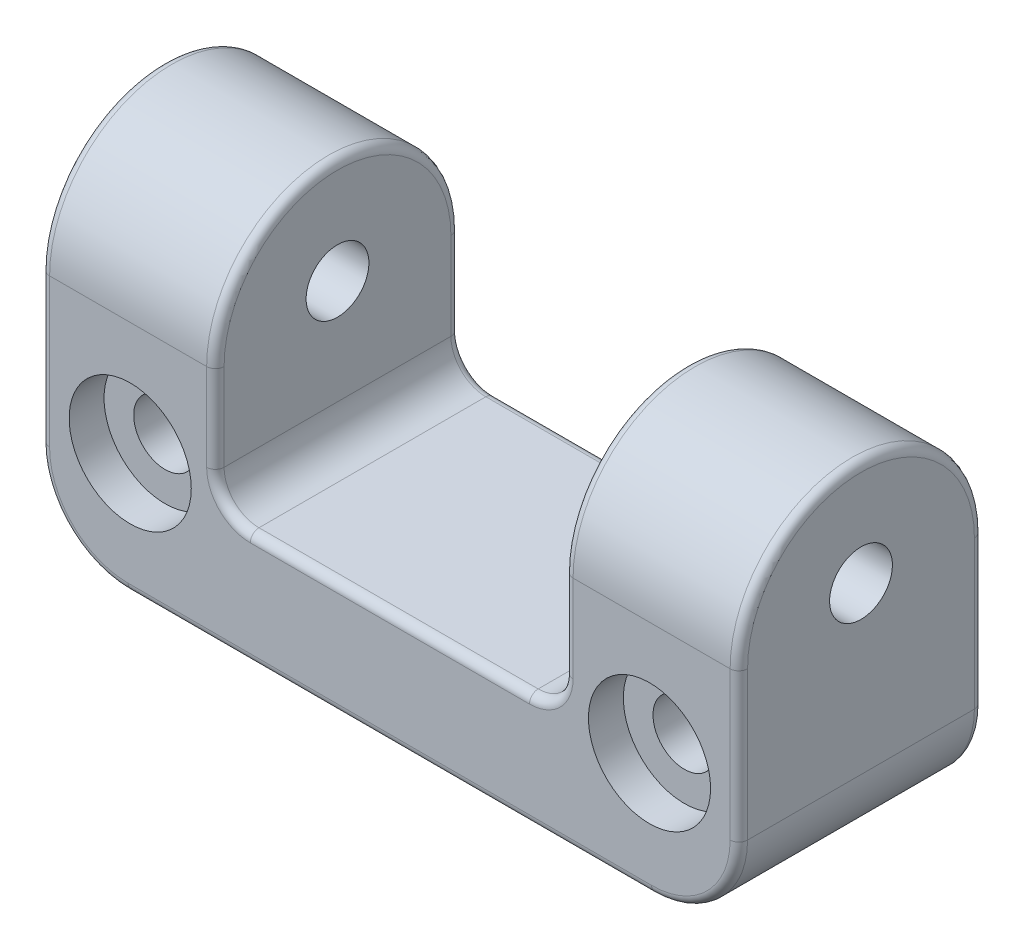
from build123d import *

# Parameters (mm, degrees)
SKETCH1_R           = 2.286000000000002
BOSS_EXTRUDE1_DEPTH = 17.779999999999998
SKETCH2_R           = 2.286
CUT_EXTRUDE1_DEPTH  = 59.35180122541205
FILLET1_R           = 9.525
FILLET2_R           = 6.349999999999998
SKETCH3_R           = 4.444999999999999
SKETCH3_R_2         = 4.444999999999996
CUT_EXTRUDE2_DEPTH  = 2.54
FILLET3_R           = 2.54
FILLET4_R           = 8.89
FILLET5_R           = 0.635


with BuildPart() as part:
    # Sketch1 → Boss-Extrude1 (new body)
    # profile 1 of 3: a face of its own
    with BuildSketch(Plane.XY):
        Polygon((-12.699999999999998, -4.1275), (12.700000000000001, -4.127499999999988), (12.700000000000001, 4.127500000000004), (-12.700000000000001, 4.1275), align=None)
    # profile 2 of 3: a face of its own
    with BuildSketch(Plane.XY):
        Polygon((12.700000000000001, 4.127500000000004), (12.700000000000001, -4.127499999999988), (25.4, -4.127499999999997), (25.39999999999999, 22.542500000000004), (12.700000000000003, 22.5425), align=None)
        with Locations((18.8976, 4.762500000000002)):
            Circle(SKETCH1_R, mode=Mode.SUBTRACT)
    # profile 3 of 3: a face of its own
    with BuildSketch(Plane.XY):
        Polygon((-25.4, -4.127500000000003), (-12.699999999999998, -4.1275), (-12.700000000000001, 4.1275), (-12.700000000000006, 22.5425), (-25.4, 22.542499999999997), align=None)
        with Locations((-18.8976, 4.7624999999999975)):
            Circle(SKETCH1_R, mode=Mode.SUBTRACT)
    extrude(amount=BOSS_EXTRUDE1_DEPTH)

    # Sketch2 → Cut-Extrude1 (cut, through all)
    with BuildSketch(Plane(origin=(25.4, 6.61e-15, 0), x_dir=(0, 0, -1), z_dir=(1, 6.2e-16, 0))):
        with Locations(Location((-8.889999999999999, 14.287499999999996, 0), (0, 0, 90))):
            Circle(SKETCH2_R)
    extrude(amount=-CUT_EXTRUDE1_DEPTH, mode=Mode.SUBTRACT)

    # Fillet1
    # the kernel refuses this fillet: 9.525 mm, written as the material it takes off along each edge
    with BuildSketch(Plane(origin=(49.21249999999999, 22.54250000000001, 0), x_dir=(2.8e-16, -1, 0), z_dir=(-1, -2.8e-16, 0)), Plane(origin=(11.11249999999999, 22.542499999999997, 0), x_dir=(0, -1, 0), z_dir=(-1, 0, 0))) as fillet1_piece_1:
        with BuildLine():
            CenterArc((FILLET1_R, FILLET1_R), FILLET1_R, 180, 90)
            Line((0, FILLET1_R), (0, 0))
            Line((0, 0), (FILLET1_R, 0))
        make_face()
    extrude(amount=60.32499999999998, mode=Mode.SUBTRACT)
    with BuildSketch(Plane(origin=(11.11249999999999, 22.542499999999997, 17.779999999999998), x_dir=(0, -1, 0), z_dir=(-1, 0, 0)), Plane(origin=(49.21249999999999, 22.54250000000001, 17.779999999999998), x_dir=(2.8e-16, -1, 0), z_dir=(-1, -2.8e-16, 0))) as fillet1_piece_2:
        with BuildLine():
            CenterArc((FILLET1_R, -FILLET1_R), FILLET1_R, 90, 90)
            Line((0, -FILLET1_R), (0, 0))
            Line((0, 0), (FILLET1_R, 0))
        make_face()
    extrude(amount=60.32499999999998, mode=Mode.SUBTRACT)

    # Fillet2
    fillet2_edges = [part.edges().sort_by_distance(p)[0] for p in [
        (25.4, -4.127499999999997, 8.889999999999999),
        (-25.4, -4.127500000000003, 8.889999999999999),
    ]]
    fillet(fillet2_edges, radius=FILLET2_R)

    # Sketch3 → Cut-Extrude2 (cut)
    with BuildSketch(Plane.XY.offset(17.779999999999998)):
        with Locations((-18.8976, 4.7624999999999975)):
            Circle(SKETCH3_R)
        with Locations((18.8976, 4.762500000000002)):
            Circle(SKETCH3_R_2)
    extrude(amount=-CUT_EXTRUDE2_DEPTH, mode=Mode.SUBTRACT)

    # Fillet3
    fillet3_edges = [part.edges().sort_by_distance(p)[0] for p in [
        (-12.700000000000001, 4.1275, 8.889999999999999),
        (12.700000000000001, 4.127500000000004, 8.889999999999999),
    ]]
    fillet(fillet3_edges, radius=FILLET3_R)

    # Fillet4
    # the kernel refuses this fillet: 8.89 mm, written as the material it takes off along each edge
    with BuildSketch(Plane(origin=(-19.834004279952136, 22.521309762405814, 8.89), x_dir=(0, -0.7302954784048413, 0.6831314033342663), z_dir=(1, 0, 0))) as fillet4_piece_1:
        with BuildLine():
            CenterArc((6.940587579719998, 6.492349293547839), FILLET4_R, 133.08904141467275, 179.99957562758698)
            ThreePointArc((0.8675253607749441, 12.984653605948957), (-2.12943437574429, 6.6635780753126035), (0, 0))
            ThreePointArc((0, 0), (6.506800855987493, -2.5689114711987417), (13.013601711974989, -7.7e-16))
        make_face()
    extrude(amount=77.76800855990426, mode=Mode.SUBTRACT)
    with BuildSketch(Plane(origin=(-57.934004254500124, 22.521309762405814, 8.89), x_dir=(0, -0.7302954779049243, 0.683131403868698), z_dir=(1, 0, 0))) as fillet4_piece_2:
        with BuildLine():
            CenterArc((6.940587574290149, 6.492349297992085), FILLET4_R, 133.08904154045896, 179.9995754598716)
            ThreePointArc((0.8675253410919979, 12.984653597060502), (-2.1294343810853733, 6.663578066799472), (0, 0))
            ThreePointArc((0, 0), (6.506800850897012, -2.568911466437052), (13.013601701794025, -6.8e-16))
        make_face()
    extrude(amount=77.76800850900023, mode=Mode.SUBTRACT)

    # Fillet5
    # the kernel refuses this fillet: 0.635 mm, written as the material it takes off along each edge
    with BuildSketch(Plane(origin=(12.700000000000003, 13.017500000000002, 0), x_dir=(1, -7e-17, 0), z_dir=(-7e-17, -1, 0))) as fillet5_piece_1:
        with BuildLine():
            CenterArc((FILLET5_R, FILLET5_R), FILLET5_R, 180, 90)
            Line((0, FILLET5_R), (0, 0))
            Line((0, 0), (FILLET5_R, 0))
        make_face()
    extrude(amount=6.349999999999998, mode=Mode.SUBTRACT)
    with BuildSketch(Plane(origin=(12.700000000000001, 6.667500000000003, 17.779999999999998), x_dir=(1, -7e-17, 0), z_dir=(7e-17, 1, 0))) as fillet5_piece_2:
        with BuildLine():
            CenterArc((FILLET5_R, FILLET5_R), FILLET5_R, 180, 90)
            Line((0, FILLET5_R), (0, 0))
            Line((0, 0), (FILLET5_R, 0))
        make_face()
    extrude(amount=6.349999999999999, mode=Mode.SUBTRACT)
    with BuildSketch(Plane(origin=(-12.700000000000001, 6.6674999999999995, 0), x_dir=(-1, -3.3e-16, 0), z_dir=(-3.3e-16, 1, 0))) as fillet5_piece_3:
        with BuildLine():
            CenterArc((FILLET5_R, FILLET5_R), FILLET5_R, 180, 90)
            Line((0, FILLET5_R), (0, 0))
            Line((0, 0), (FILLET5_R, 0))
        make_face()
    extrude(amount=6.350000000000002, mode=Mode.SUBTRACT)
    with BuildSketch(Plane(origin=(-12.700000000000003, 13.0175, 17.779999999999998), x_dir=(-1, -3.3e-16, 0), z_dir=(3.3e-16, -1, 0))) as fillet5_piece_4:
        with BuildLine():
            CenterArc((FILLET5_R, FILLET5_R), FILLET5_R, 180, 90)
            Line((0, FILLET5_R), (0, 0))
            Line((0, 0), (FILLET5_R, 0))
        make_face()
    extrude(amount=6.35, mode=Mode.SUBTRACT)
    with BuildSketch(Plane(origin=(10.16, 6.667500000000004, 0), x_dir=(1, 3.5e-16, 0), z_dir=(-3.5e-16, 1, 0))) as fillet5_piece_5:
        with BuildLine():
            CenterArc((2.539999999999999 + FILLET5_R, -FILLET5_R), FILLET5_R, 90, 90)
            Line((2.539999999999999, -FILLET5_R), (2.539999999999999, 0))
            Line((2.539999999999999, 0), (2.539999999999999 + FILLET5_R, 0))
        make_face()
    revolve(axis=Axis((10.16, 6.667500000000004, 0), (0, 0, -1)), revolution_arc=90, mode=Mode.SUBTRACT)
    with BuildSketch(Plane(origin=(10.16, 6.667500000000004, 17.779999999999998), x_dir=(1, 3.5e-16, 0), z_dir=(-3.5e-16, 1, 0))) as fillet5_piece_6:
        with BuildLine():
            CenterArc((2.539999999999999 + FILLET5_R, FILLET5_R), FILLET5_R, 180, 90)
            Line((2.539999999999999, FILLET5_R), (2.539999999999999, 0))
            Line((2.539999999999999, 0), (2.539999999999999 + FILLET5_R, 0))
        make_face()
    revolve(axis=Axis((10.16, 6.667500000000004, 17.779999999999998), (0, 0, -1)), revolution_arc=90, mode=Mode.SUBTRACT)
    with BuildSketch(Plane(origin=(-10.160000000000002, 6.6675, 0), x_dir=(-1, 3.5e-16, 0), z_dir=(3.5e-16, 1, 0))) as fillet5_piece_7:
        with BuildLine():
            CenterArc((2.540000000000001 + FILLET5_R, FILLET5_R), FILLET5_R, 180, 90)
            Line((2.540000000000001, FILLET5_R), (2.540000000000001, 0))
            Line((2.540000000000001, 0), (2.540000000000001 + FILLET5_R, 0))
        make_face()
    revolve(axis=Axis((-10.160000000000002, 6.6675, 0), (0, 0, 1)), revolution_arc=90, mode=Mode.SUBTRACT)
    with BuildSketch(Plane(origin=(-10.160000000000002, 6.6675, 17.779999999999998), x_dir=(-1, 3.5e-16, 0), z_dir=(3.5e-16, 1, 0))) as fillet5_piece_8:
        with BuildLine():
            CenterArc((2.540000000000001 + FILLET5_R, -FILLET5_R), FILLET5_R, 90, 90)
            Line((2.540000000000001, -FILLET5_R), (2.540000000000001, 0))
            Line((2.540000000000001, 0), (2.540000000000001 + FILLET5_R, 0))
        make_face()
    revolve(axis=Axis((-10.160000000000002, 6.6675, 17.779999999999998), (0, 0, 1)), revolution_arc=90, mode=Mode.SUBTRACT)
    with BuildSketch(Plane(origin=(25.399999999999995, 13.017502351626003, 8.889999999992654), x_dir=(0, 3.7033476170192908e-06, 0.9999999999931426), z_dir=(0, -0.9999999999931426, 3.7033476170192908e-06))) as fillet5_piece_9:
        with BuildLine():
            CenterArc((8.889999999999999 - FILLET5_R, FILLET5_R), FILLET5_R, 270, 90)
            Line((8.889999999999999 - FILLET5_R, -3.55e-15), (8.889999999999999, 0))
            Line((8.889999999999999, 0), (8.889999999999999, FILLET5_R))
        make_face()
    revolve(axis=Axis((25.399999999999995, 13.017502351626003, 8.889999999992654), (-1, 0, 0)), revolution_arc=179.99957562758703, mode=Mode.SUBTRACT)
    with BuildSketch(Plane(origin=(12.7, 13.017502351626003, 8.889999999992654), x_dir=(0, 3.7033476170192908e-06, 0.9999999999931426), z_dir=(0, -0.9999999999931426, 3.7033476170192908e-06))) as fillet5_piece_10:
        with BuildLine():
            CenterArc((8.889999999999999 - FILLET5_R, -FILLET5_R), FILLET5_R, 0, 90)
            Line((8.889999999999999 - FILLET5_R, 1.78e-15), (8.889999999999999, 0))
            Line((8.889999999999999, 0), (8.889999999999999, -FILLET5_R))
        make_face()
    revolve(axis=Axis((12.7, 13.017502351626003, 8.889999999992654), (-1, 0, 0)), revolution_arc=179.99957562758703, mode=Mode.SUBTRACT)
    with BuildSketch(Plane(origin=(-12.700000000000006, 13.017502351626003, 8.889999999992654), x_dir=(0, 3.7033476170192908e-06, 0.9999999999931426), z_dir=(0, -0.9999999999931426, 3.7033476170192908e-06))) as fillet5_piece_11:
        with BuildLine():
            CenterArc((8.889999999999999 - FILLET5_R, FILLET5_R), FILLET5_R, 270, 90)
            Line((8.889999999999999 - FILLET5_R, 0), (8.889999999999999, 0))
            Line((8.889999999999999, 0), (8.889999999999999, FILLET5_R))
        make_face()
    revolve(axis=Axis((-12.700000000000006, 13.017502351626003, 8.889999999992654), (-1, 0, 0)), revolution_arc=179.99957562758703, mode=Mode.SUBTRACT)
    with BuildSketch(Plane(origin=(-25.4, 13.017502352555672, 8.889999999997206), x_dir=(0, 3.7048116909257714e-06, 0.9999999999931372), z_dir=(0, -0.9999999999931372, 3.7048116909257714e-06))) as fillet5_piece_12:
        with BuildLine():
            CenterArc((8.890000000000002 - FILLET5_R * 1.00000000146, -FILLET5_R), FILLET5_R, 0, 90)
            Line((8.890000000000002 - FILLET5_R * 1.00000000146, 0), (8.890000000000002, 0))
            Line((8.890000000000002, 0), (8.890000000000002 - FILLET5_R * 1.46404813032e-09, -FILLET5_R))
        make_face()
    revolve(axis=Axis((-25.4, 13.017502352555672, 8.889999999997206), (-1, 0, 0)), revolution_arc=179.99957545987195, mode=Mode.SUBTRACT)
    with BuildSketch(Plane(origin=(25.4, 2.222500000000016, 0), x_dir=(-1, -2.7e-16, 0), z_dir=(-2.7e-16, 1, 0))) as fillet5_piece_13:
        with BuildLine():
            CenterArc((FILLET5_R, FILLET5_R), FILLET5_R, 180, 90)
            Line((0, FILLET5_R), (0, 0))
            Line((0, 0), (FILLET5_R, 0))
        make_face()
    extrude(amount=10.794999999999986, mode=Mode.SUBTRACT)
    with BuildSketch(Plane(origin=(25.4, 2.222500000000016, 17.779999999999998), x_dir=(-1, -2.7e-16, 0), z_dir=(-2.7e-16, 1, 0))) as fillet5_piece_14:
        with BuildLine():
            CenterArc((FILLET5_R, -FILLET5_R), FILLET5_R, 90, 90)
            Line((0, -FILLET5_R), (0, 0))
            Line((0, 0), (FILLET5_R, 0))
        make_face()
    extrude(amount=10.794999999999982, mode=Mode.SUBTRACT)
    with BuildSketch(Plane(origin=(-19.049999999999997, -4.127500000000002, 0), x_dir=(-1.2e-16, 1, 0), z_dir=(1, 1.2e-16, 0))) as fillet5_piece_15:
        with BuildLine():
            CenterArc((FILLET5_R, FILLET5_R), FILLET5_R, 180, 90)
            Line((0, FILLET5_R), (0, 0))
            Line((0, 0), (FILLET5_R, 0))
        make_face()
    extrude(amount=38.1, mode=Mode.SUBTRACT)
    with BuildSketch(Plane(origin=(-25.4, 13.017500000000002, 0), x_dir=(1, 0, 0), z_dir=(0, -1, 0))) as fillet5_piece_16:
        with BuildLine():
            CenterArc((FILLET5_R, FILLET5_R), FILLET5_R, 180, 90)
            Line((0, FILLET5_R), (0, 0))
            Line((0, 0), (FILLET5_R, 0))
        make_face()
    extrude(amount=10.795000000000009, mode=Mode.SUBTRACT)
    with BuildSketch(Plane(origin=(-19.05, 2.222499999999994, 0), x_dir=(1.12e-15, -1, 0), z_dir=(1, 1.12e-15, 0))) as fillet5_piece_17:
        with BuildLine():
            CenterArc((6.349999999999998 - FILLET5_R, -FILLET5_R), FILLET5_R, 1.002e-14, 90)
            Line((6.349999999999999, -FILLET5_R), (6.349999999999998, 0))
            Line((6.349999999999998, 0), (6.349999999999998 - FILLET5_R, 0))
        make_face()
    revolve(axis=Axis((-19.05, 2.222499999999994, 0), (0, 0, -1)), revolution_arc=90.00000000000006, mode=Mode.SUBTRACT)
    with BuildSketch(Plane(origin=(19.049999999999997, 2.2225000000000144, 0), x_dir=(1.12e-15, -1, 0), z_dir=(-1, -1.12e-15, 0))) as fillet5_piece_18:
        with BuildLine():
            CenterArc((6.35 - FILLET5_R, FILLET5_R), FILLET5_R, 270, 89.99999999999999)
            Line((6.35, FILLET5_R), (6.35, 0))
            Line((6.35, 0), (6.35 - FILLET5_R, 0))
        make_face()
    revolve(axis=Axis((19.049999999999997, 2.2225000000000144, 0), (0, 0, 1)), revolution_arc=89.99999999999996, mode=Mode.SUBTRACT)
    with BuildSketch(Plane(origin=(19.05, -4.127499999999998, 17.779999999999998), x_dir=(-1.2e-16, 1, 0), z_dir=(-1, -1.2e-16, 0))) as fillet5_piece_19:
        with BuildLine():
            CenterArc((FILLET5_R, FILLET5_R), FILLET5_R, 180, 90)
            Line((0, FILLET5_R), (0, 0))
            Line((0, 0), (FILLET5_R, 0))
        make_face()
    extrude(amount=38.099999999999994, mode=Mode.SUBTRACT)
    with BuildSketch(Plane(origin=(-25.4, 13.0175, 17.779999999999998), x_dir=(1, 0, 0), z_dir=(0, -1, 0))) as fillet5_piece_20:
        with BuildLine():
            CenterArc((FILLET5_R, -FILLET5_R), FILLET5_R, 90, 90)
            Line((0, -FILLET5_R), (0, 0))
            Line((0, 0), (FILLET5_R, 0))
        make_face()
    extrude(amount=10.795000000000007, mode=Mode.SUBTRACT)
    with BuildSketch(Plane(origin=(-19.05, 2.222499999999994, 17.779999999999998), x_dir=(1.12e-15, -1, 0), z_dir=(1, 1.12e-15, 0))) as fillet5_piece_21:
        with BuildLine():
            CenterArc((6.349999999999998 - FILLET5_R, FILLET5_R), FILLET5_R, 270, 90)
            Line((6.349999999999999, FILLET5_R), (6.349999999999998, 0))
            Line((6.349999999999998, 0), (6.349999999999998 - FILLET5_R, 0))
        make_face()
    revolve(axis=Axis((-19.05, 2.222499999999994, 17.779999999999998), (0, 0, -1)), revolution_arc=90.00000000000006, mode=Mode.SUBTRACT)
    with BuildSketch(Plane(origin=(19.049999999999997, 2.2225000000000144, 17.779999999999998), x_dir=(5.6e-16, -1, 0), z_dir=(-1, -5.6e-16, 0))) as fillet5_piece_22:
        with BuildLine():
            CenterArc((6.349999999999998 - FILLET5_R, -FILLET5_R), FILLET5_R, 0, 90)
            Line((6.349999999999998, -FILLET5_R), (6.349999999999998, 0))
            Line((6.349999999999998, 0), (6.349999999999998 - FILLET5_R, 0))
        make_face()
    revolve(axis=Axis((19.049999999999997, 2.2225000000000144, 17.779999999999998), (0, 0, 1)), revolution_arc=89.99999999999999, mode=Mode.SUBTRACT)
    with BuildSketch(Plane(origin=(10.16, 4.127500000000004, 0), x_dir=(1.4e-16, -1, 0), z_dir=(-1, -1.4e-16, 0))) as fillet5_piece_23:
        with BuildLine():
            CenterArc((FILLET5_R, FILLET5_R), FILLET5_R, 180, 90)
            Line((0, FILLET5_R), (0, 0))
            Line((0, 0), (FILLET5_R, 0))
        make_face()
    extrude(amount=20.32, mode=Mode.SUBTRACT)
    with BuildSketch(Plane(origin=(10.16, 4.127500000000004, 17.779999999999998), x_dir=(1.4e-16, -1, 0), z_dir=(-1, -1.4e-16, 0))) as fillet5_piece_24:
        with BuildLine():
            CenterArc((FILLET5_R, -FILLET5_R), FILLET5_R, 90, 90)
            Line((0, -FILLET5_R), (0, 0))
            Line((0, 0), (FILLET5_R, 0))
        make_face()
    extrude(amount=20.32, mode=Mode.SUBTRACT)
    with BuildSketch(Plane(origin=(-25.400000000000002, 13.0175, 8.255), x_dir=(0, 3.7048116949886797e-06, 0.9999999999931372), z_dir=(0, 0.9999999999931372, -3.7048116949886797e-06))) as fillet5_piece_25:
        with BuildLine():
            CenterArc((9.524999999999999 - FILLET5_R, FILLET5_R), FILLET5_R, 270, 90)
            Line((9.524999999999999, FILLET5_R), (9.524999999999999, 0))
            Line((9.524999999999999, 0), (9.524999999999999 - FILLET5_R, 3.55e-15))
        make_face()
    revolve(axis=Axis((-25.400000000000002, 13.0175, 8.255), (1, 0, 0)), revolution_arc=0.00021227007400047, mode=Mode.SUBTRACT)
    with BuildSketch(Plane(origin=(-25.400000000000002, 13.0175, 9.525), x_dir=(0, 1.9e-16, -1), z_dir=(0, -1, -1.9e-16))) as fillet5_piece_26:
        with BuildLine():
            CenterArc((9.525 - FILLET5_R, FILLET5_R), FILLET5_R, 270, 90)
            Line((9.525 - FILLET5_R, 3.55e-15), (9.525, 0))
            Line((9.525, 0), (9.525, FILLET5_R))
        make_face()
    revolve(axis=Axis((-25.400000000000002, 13.0175, 9.525), (1, 0, 0)), revolution_arc=0.00021227005730892, mode=Mode.SUBTRACT)
    with BuildSketch(Plane(origin=(25.4, 13.0175, 8.255), x_dir=(0, 3.703347646485368e-06, 0.9999999999931426), z_dir=(0, 0.9999999999931426, -3.703347646485368e-06))) as fillet5_piece_27:
        with BuildLine():
            CenterArc((9.525000000000004 - FILLET5_R, -FILLET5_R), FILLET5_R, 3.2056e-13, 89.99999999999966)
            Line((9.525000000000004, -FILLET5_R), (9.525000000000004, 0))
            Line((9.525000000000004, 0), (9.525000000000004 - FILLET5_R, -3.55e-15))
        make_face()
    revolve(axis=Axis((25.4, 13.0175, 8.255), (1, 0, 0)), revolution_arc=0.00021218619020397, mode=Mode.SUBTRACT)
    with BuildSketch(Plane(origin=(25.4, 13.0175, 9.525), x_dir=(0, 1.9e-16, -1), z_dir=(0, -1, -1.9e-16))) as fillet5_piece_28:
        with BuildLine():
            CenterArc((9.525000000000002 - FILLET5_R, -FILLET5_R), FILLET5_R, 0, 90)
            Line((9.525000000000002 - FILLET5_R, 0), (9.525000000000002, 0))
            Line((9.525000000000002, 0), (9.525000000000002, -FILLET5_R))
        make_face()
    revolve(axis=Axis((25.4, 13.0175, 9.525), (1, 0, 0)), revolution_arc=0.00021218622311635, mode=Mode.SUBTRACT)
    with BuildSketch(Plane(origin=(-12.700000000000006, 13.0175, 8.255), x_dir=(0, 3.703347646485368e-06, 0.9999999999931426), z_dir=(0, 0.9999999999931426, -3.703347646485368e-06))) as fillet5_piece_29:
        with BuildLine():
            CenterArc((9.525000000000004 - FILLET5_R, -FILLET5_R), FILLET5_R, 0, 90)
            Line((9.525000000000004 - FILLET5_R, 1.78e-15), (9.525000000000004, 0))
            Line((9.525000000000004, 0), (9.525000000000004, -FILLET5_R))
        make_face()
    revolve(axis=Axis((-12.700000000000006, 13.0175, 8.255), (1, 0, 0)), revolution_arc=0.00021218619020397, mode=Mode.SUBTRACT)
    with BuildSketch(Plane(origin=(-12.700000000000006, 13.0175, 9.525), x_dir=(0, 1.9e-16, -1), z_dir=(0, -1, -1.9e-16))) as fillet5_piece_30:
        with BuildLine():
            CenterArc((9.525000000000002 - FILLET5_R, -FILLET5_R), FILLET5_R, 0, 90)
            Line((9.525000000000002 - FILLET5_R, 1.78e-15), (9.525000000000002, 0))
            Line((9.525000000000002, 0), (9.525000000000002, -FILLET5_R))
        make_face()
    revolve(axis=Axis((-12.700000000000006, 13.0175, 9.525), (1, 0, 0)), revolution_arc=0.00021218622311635, mode=Mode.SUBTRACT)
    with BuildSketch(Plane(origin=(12.700000000000003, 13.0175, 8.255), x_dir=(0, 3.703347646485368e-06, 0.9999999999931426), z_dir=(0, 0.9999999999931426, -3.703347646485368e-06))) as fillet5_piece_31:
        with BuildLine():
            CenterArc((9.525000000000004 - FILLET5_R, FILLET5_R), FILLET5_R, 270, 90)
            Line((9.525000000000004 - FILLET5_R, -1.78e-15), (9.525000000000004, 0))
            Line((9.525000000000004, 0), (9.525000000000004, FILLET5_R))
        make_face()
    revolve(axis=Axis((12.700000000000003, 13.0175, 8.255), (1, 0, 0)), revolution_arc=0.00021218619020397, mode=Mode.SUBTRACT)
    with BuildSketch(Plane(origin=(12.700000000000003, 13.0175, 9.525), x_dir=(0, 1.9e-16, -1), z_dir=(0, -1, -1.9e-16))) as fillet5_piece_32:
        with BuildLine():
            CenterArc((9.525000000000002 - FILLET5_R, FILLET5_R), FILLET5_R, 270, 90)
            Line((9.525000000000002 - FILLET5_R, -1.78e-15), (9.525000000000002, 0))
            Line((9.525000000000002, 0), (9.525000000000002, FILLET5_R))
        make_face()
    revolve(axis=Axis((12.700000000000003, 13.0175, 9.525), (1, 0, 0)), revolution_arc=0.00021218622311635, mode=Mode.SUBTRACT)


solid = part.part
